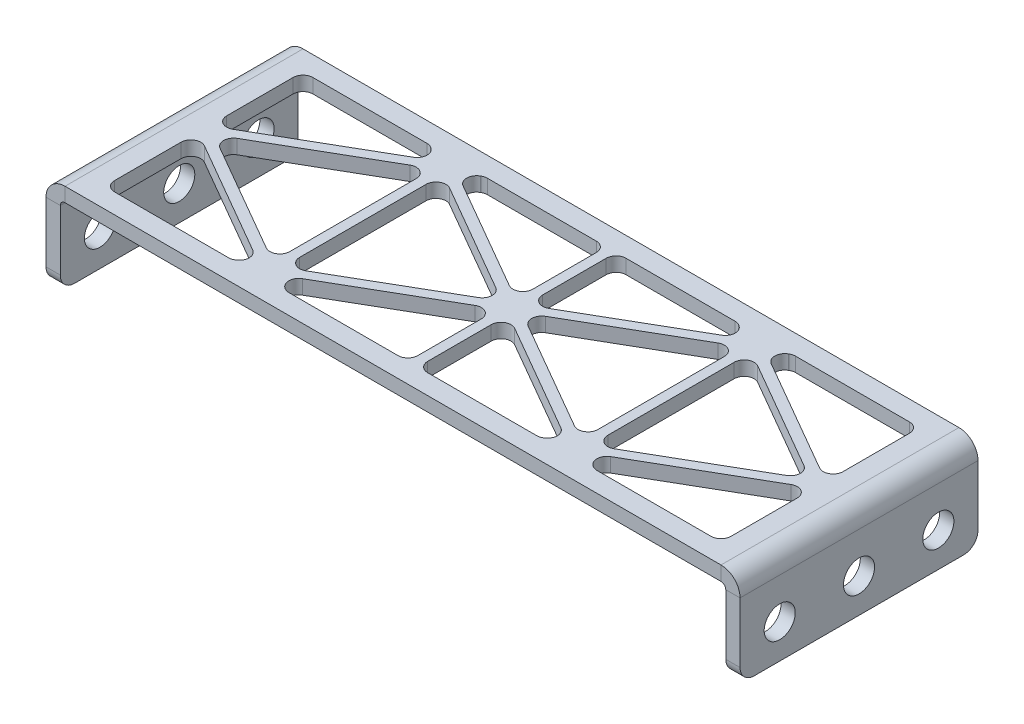
from build123d import *

# Parameters (mm, degrees)
BASE_FLANGE1_DEPTH      = 38.1
CUT_EXTRUDE1_DEPTH      = 68.92188088
CUT_EXTRUDE1_DEPTH_BACK = 68.92188088
SKETCH6_R               = 2.4892
CUT_EXTRUDE2_DEPTH      = 70.01725583
FILLET1_R               = 1.5875
FILLET2_R               = 2.286


# Sheet-metal steps are written as plain solids
with BuildPart() as part:
    # Sketch1 → Base-Flange1 (new body)
    with BuildSketch(Plane.XY):
        with BuildLine():
            Line((-53.2765, -6.35), (-53.2765, 5.588))
            ThreePointArc((-53.2765, 5.588), (-53.053315367, 6.126815367), (-52.5145, 6.35))
            Line((-52.5145, 6.35), (52.5145, 6.35))
            ThreePointArc((52.5145, 6.35), (53.053315367, 6.126815367), (53.2765, 5.588))
            Line((53.2765, 5.588), (53.2765, -6.35))
            Line((53.2765, -6.35), (55.5625, -6.35))
            Line((55.5625, -6.35), (55.5625, 5.588))
            ThreePointArc((55.5625, 5.588), (54.669761469, 7.743261469), (52.5145, 8.636))
            Line((52.5145, 8.636), (-52.5145, 8.636))
            ThreePointArc((-52.5145, 8.636), (-54.669761469, 7.743261469), (-55.5625, 5.588))
            Line((-55.5625, 5.588), (-55.5625, -6.35))
            Line((-55.5625, -6.35), (-53.2765, -6.35))
        make_face()
    extrude(amount=BASE_FLANGE1_DEPTH)

    # Sketch6 → Cut-Extrude1 (cut, two sides: drawn at the far end of the back side and taken through both)
    with BuildSketch(Plane(origin=(0, 0, 0), x_dir=(0, 0, -1), z_dir=(1, 0, 0)).offset(-CUT_EXTRUDE1_DEPTH_BACK)):
        with Locations((6.35, -0.888959106)):
            Circle(SKETCH6_R)
        with Locations((-6.35, -0.888959106)):
            Circle(SKETCH6_R)
        with Locations((-19.05, -0.888959106)):
            Circle(SKETCH6_R)
        with Locations((-31.75, -0.888959106)):
            Circle(SKETCH6_R)
    extrude(amount=CUT_EXTRUDE1_DEPTH + CUT_EXTRUDE1_DEPTH_BACK, mode=Mode.SUBTRACT)

    # Sketch7 → Cut-Extrude2 (cut, through all)
    with BuildSketch(Plane(origin=(0, 8.636, 0), x_dir=(1, 0, 0), z_dir=(0, 1, 0))):
        Polygon((-26.25725, -4.806913197), (-29.08380657, -3.175), (-48.54575, -3.175), (-48.54575, -17.675184671), align=None)
        Polygon((-48.54575, -17.675184671), (-48.54575, -3.175), (-49.3395, -3.175), (-49.3395, -18.133456448), align=None)
        Polygon((-48.54575, -34.925), (-48.54575, -20.424815329), (-49.3395, -19.966543552), (-49.3395, -34.925), align=None)
        Polygon((-25.4635, -31.918271475), (-25.4635, -6.181728525), (-47.752, -19.05), align=None)
        Polygon((-27.89318157, -34.237592336), (-26.25725, -33.293086803), (-48.54575, -20.424815329), (-48.54575, -34.925), (-29.08380657, -34.925), align=None)
        Polygon((-23.876, -31.918271475), (-1.5875, -19.05), (-23.876, -6.181728525), align=None)
        Polygon((-0.79375, -17.675184671), (-0.79375, -3.175), (-20.25569343, -3.175), (-21.44631843, -3.862407664), (-23.08225, -4.806913197), align=None)
        Polygon((-0.79375, -34.925), (-0.79375, -20.424815329), (-23.08225, -33.293086803), (-21.44631843, -34.237592336), (-20.25569343, -34.925), align=None)
        Polygon((21.44631843, -3.862407664), (20.25569343, -3.175), (0.79375, -3.175), (0.79375, -17.675184671), (23.08225, -4.806913197), align=None)
        Polygon((23.876, -31.918271475), (23.876, -6.181728525), (1.5875, -19.05), align=None)
        Polygon((48.54575, -34.925), (48.54575, -20.424815329), (26.25725, -33.293086803), (27.89318157, -34.237592336), (29.08380657, -34.925), align=None)
        Polygon((25.4635, -31.918271475), (47.752, -19.05), (25.4635, -6.181728525), align=None)
        Polygon((48.54575, -17.675184671), (48.54575, -3.175), (29.08380657, -3.175), (26.25725, -4.806913197), align=None)
        Polygon((49.3395, -34.925), (49.3395, -19.966543552), (48.54575, -20.424815329), (48.54575, -34.925), align=None)
        Polygon((49.3395, -18.133456448), (49.3395, -3.175), (48.54575, -3.175), (48.54575, -17.675184671), align=None)
        Polygon((21.44631843, -34.237592336), (23.08225, -33.293086803), (0.79375, -20.424815329), (0.79375, -34.925), (20.25569343, -34.925), align=None)
    extrude(amount=-CUT_EXTRUDE2_DEPTH, mode=Mode.SUBTRACT)

    # Fillet1
    fillet1_edges = [part.edges().sort_by_distance(p)[0] for p in [
        (-20.25569343, 7.493, 34.925),
        (-23.08225, 7.493, 33.293086803),
        (-0.79375, 7.493, 20.424815329),
        (-0.79375, 7.493, 34.925),
        (20.25569343, 7.493, 3.175),
        (23.08225, 7.493, 4.806913197),
        (0.79375, 7.493, 17.675184671),
        (0.79375, 7.493, 3.175),
        (1.5875, 7.493, 19.05),
        (23.876, 7.493, 6.181728525),
        (23.876, 7.493, 31.918271475),
        (25.4635, 7.493, 31.918271475),
        (25.4635, 7.493, 6.181728525),
        (47.752, 7.493, 19.05),
        (-23.876, 7.493, 31.918271475),
        (-23.876, 7.493, 6.181728525),
        (-1.5875, 7.493, 19.05),
        (-23.08225, 7.493, 4.806913197),
        (-20.25569343, 7.493, 3.175),
        (-0.79375, 7.493, 3.175),
        (-0.79375, 7.493, 17.675184671),
        (-47.752, 7.493, 19.05),
        (-25.4635, 7.493, 6.181728525),
        (-25.4635, 7.493, 31.918271475),
        (-29.08380657, 7.493, 34.925),
        (-49.3395, 7.493, 34.925),
        (-49.3395, 7.493, 19.966543552),
        (-26.25725, 7.493, 33.293086803),
        (29.08380657, 7.493, 34.925),
        (26.25725, 7.493, 33.293086803),
        (49.3395, 7.493, 19.966543552),
        (49.3395, 7.493, 34.925),
        (26.25725, 7.493, 4.806913197),
        (29.08380657, 7.493, 3.175),
        (49.3395, 7.493, 3.175),
        (49.3395, 7.493, 18.133456448),
        (23.08225, 7.493, 33.293086803),
        (20.25569343, 7.493, 34.925),
        (0.79375, 7.493, 34.925),
        (0.79375, 7.493, 20.424815329),
        (-49.3395, 7.493, 3.175),
        (-29.08380657, 7.493, 3.175),
        (-26.25725, 7.493, 4.806913197),
        (-49.3395, 7.493, 18.133456448),
    ]]
    fillet(fillet1_edges, radius=FILLET1_R)

    # Fillet2
    fillet2_edges = [part.edges().sort_by_distance(p)[0] for p in [
        (54.4195, -6.35, 0),
        (-54.4195, -6.35, 0),
        (54.4195, -6.35, 38.1),
        (-54.4195, -6.35, 38.1),
    ]]
    fillet(fillet2_edges, radius=FILLET2_R)


solid = part.part
